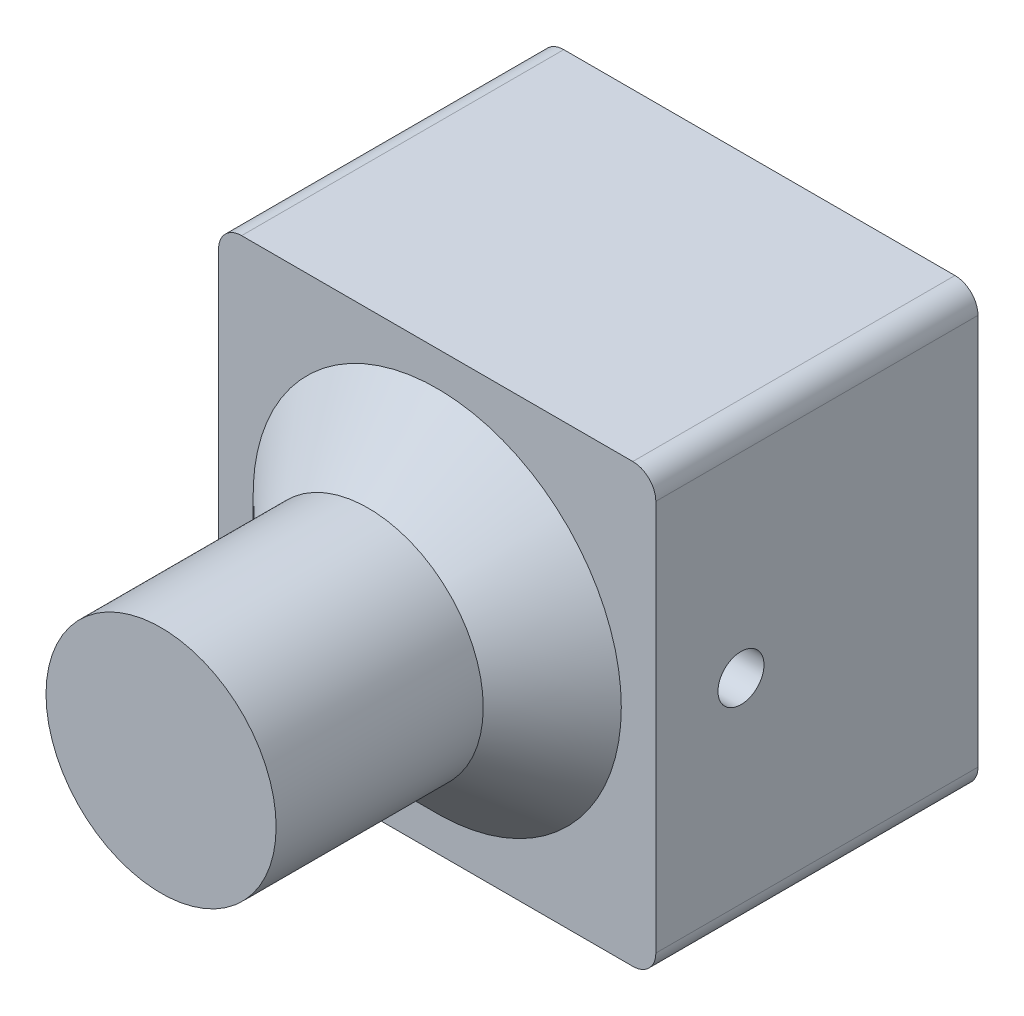
from build123d import *

# Parameters (mm, degrees)
SKETCH1_W           = 19
SKETCH1_H           = 19
BOSS_EXTRUDE1_DEPTH = 14
FILLET1_R           = 1
SKETCH2_R           = 5
BOSS_EXTRUDE2_DEPTH = 12
CHAMFER1_SIZE       = 3
SKETCH3_R           = 1
CUT_EXTRUDE1_DEPTH  = 5
CUT_EXTRUDE2_START  = -5
SKETCH4_R           = 1
CUT_EXTRUDE2_DEPTH  = 5


with BuildPart() as part:
    # Sketch1 → Boss-Extrude1 (new body)
    with BuildSketch(Plane.XY):
        with Locations((66.227433771, 51.961607523)):
            Rectangle(SKETCH1_W, SKETCH1_H)
    extrude(amount=BOSS_EXTRUDE1_DEPTH)

    # Fillet1
    fillet1_edges = [part.edges().sort_by_distance(p)[0] for p in [
        (75.727433771, 42.461607523, 7),
        (56.727433771, 42.461607523, 7),
        (75.727433771, 61.461607523, 7),
        (56.727433771, 61.461607523, 7),
    ]]
    fillet(fillet1_edges, radius=FILLET1_R)

    # Sketch2 → Boss-Extrude2 (add)
    with BuildSketch(Plane.XY.offset(14)):
        with Locations((66.227433771, 51.961607523)):
            Circle(SKETCH2_R)
    extrude(amount=BOSS_EXTRUDE2_DEPTH)

    # Chamfer1
    chamfer1_edges = [part.edges().sort_by_distance(p)[0] for p in [
        (61.227433771, 51.961607523, 14),
    ]]
    chamfer(chamfer1_edges, length=CHAMFER1_SIZE)

    # Sketch3 → Cut-Extrude1 (cut)
    with BuildSketch(Plane.ZY.offset(-56.727433771)):
        with Locations((10.3, 51.961607523)):
            Circle(SKETCH3_R)
    extrude(amount=-CUT_EXTRUDE1_DEPTH, mode=Mode.SUBTRACT)

    # Sketch4 → Cut-Extrude2 (cut)
    with BuildSketch(Plane(origin=(75.727433771, 0, 0), x_dir=(0, 0, -1), z_dir=(1, 0, 0)).offset(CUT_EXTRUDE2_START)):
        with Locations((-10.3, 51.961607523)):
            Circle(SKETCH4_R)
    extrude(amount=CUT_EXTRUDE2_DEPTH, mode=Mode.SUBTRACT)


solid = part.part
